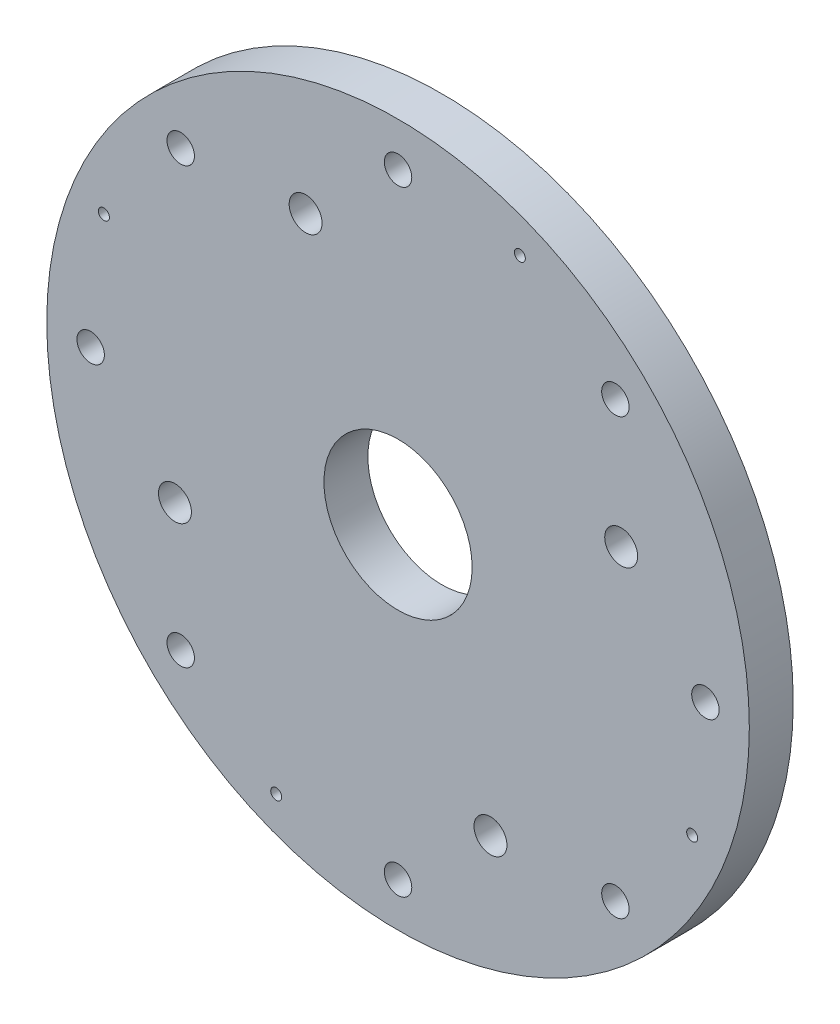
from build123d import *

# Parameters (mm, degrees)
CROQUIS1_R              = 32
SALIENTE_EXTRUIR1_DEPTH = 4
CROQUIS2_R              = 1.25
CORTAR_EXTRUIR1_DEPTH   = 46.431266766
CROQUIS3_R              = 6.75
CORTAR_EXTRUIR2_DEPTH   = 10
CROQUIS4_R              = 0.5
CORTAR_EXTRUIR3_DEPTH   = 10
CROQUIS5_R              = 1.5
CORTAR_EXTRUIR4_DEPTH   = 10


with BuildPart() as part:
    # Croquis1 → Saliente-Extruir1 (new body)
    with BuildSketch(Plane.XY):
        Circle(CROQUIS1_R)
    extrude(amount=SALIENTE_EXTRUIR1_DEPTH)

    # Croquis2 → Cortar-Extruir1 (cut, through all)
    with BuildSketch(Plane.XY.offset(4)):
        with Locations((0, 28)):
            Circle(CROQUIS2_R)
        with Locations((19.798989873, 19.798989873)):
            Circle(CROQUIS2_R)
        with Locations((28, 0)):
            Circle(CROQUIS2_R)
        with Locations((19.798989873, -19.798989873)):
            Circle(CROQUIS2_R)
        with Locations((0, -28)):
            Circle(CROQUIS2_R)
        with Locations((-19.798989873, -19.798989873)):
            Circle(CROQUIS2_R)
        with Locations((-28, 0)):
            Circle(CROQUIS2_R)
        with Locations((-19.798989873, 19.798989873)):
            Circle(CROQUIS2_R)
    extrude(amount=-CORTAR_EXTRUIR1_DEPTH, mode=Mode.SUBTRACT)

    # Croquis3 → Cortar-Extruir2 (cut)
    with BuildSketch(Plane.XY.offset(4)):
        Circle(CROQUIS3_R)
    extrude(amount=-CORTAR_EXTRUIR2_DEPTH, mode=Mode.SUBTRACT)

    # Croquis4 → Cortar-Extruir3 (cut)
    with BuildSketch(Plane(origin=(0, 0, 0), x_dir=(-1, 0, 0), z_dir=(0, 0, -1))):
        with Locations((-11.097819539, 26.792506443)):
            Circle(CROQUIS4_R)
        with Locations((26.792506443, 11.097819539)):
            Circle(CROQUIS4_R)
        with Locations((11.097819539, -26.792506443)):
            Circle(CROQUIS4_R)
        with Locations((-26.792506443, -11.097819539)):
            Circle(CROQUIS4_R)
    extrude(amount=-CORTAR_EXTRUIR3_DEPTH, mode=Mode.SUBTRACT)

    # Croquis5 → Cortar-Extruir4 (cut)
    with BuildSketch(Plane(origin=(0, 0, 0), x_dir=(-1, 0, 0), z_dir=(0, 0, -1))):
        with Locations((8.419035512, 20.325349715)):
            Circle(CROQUIS5_R)
        with Locations((20.325349715, -8.419035512)):
            Circle(CROQUIS5_R)
        with Locations((-8.419035512, -20.325349715)):
            Circle(CROQUIS5_R)
        with Locations((-20.325349715, 8.419035512)):
            Circle(CROQUIS5_R)
    extrude(amount=-CORTAR_EXTRUIR4_DEPTH, mode=Mode.SUBTRACT)


solid = part.part
